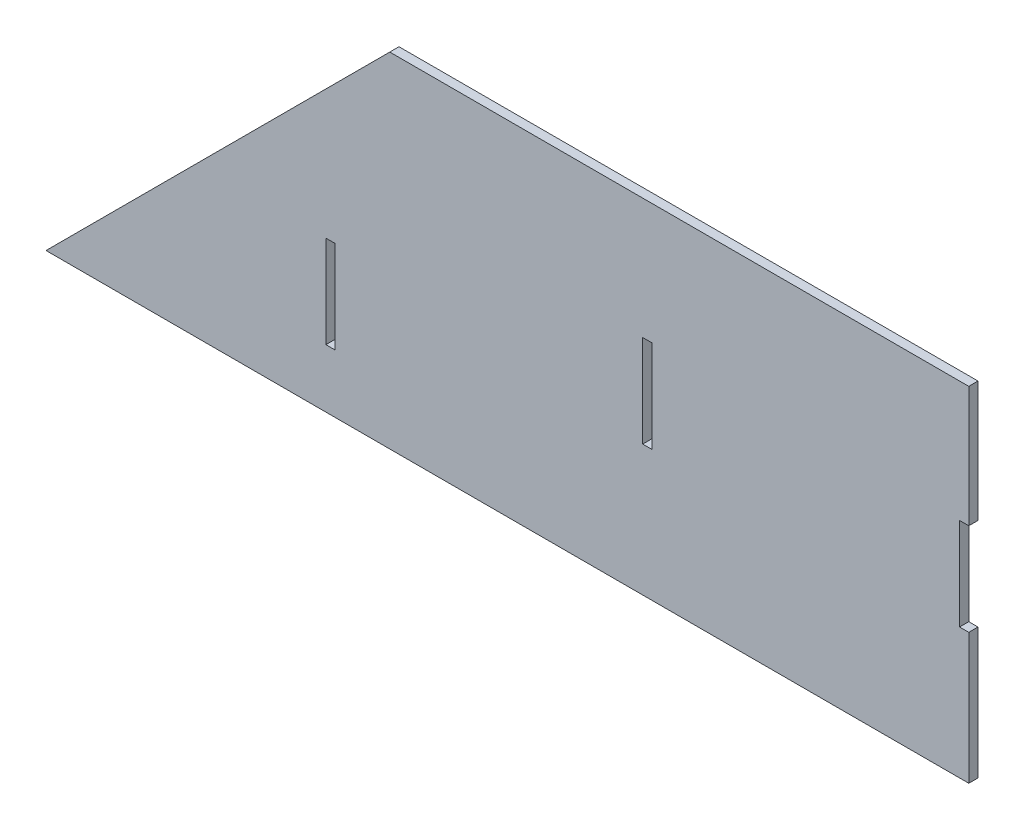
from build123d import *

# Parameters (mm, degrees)
SKETCH1_W           = 3
SKETCH1_H           = 30
BOSS_EXTRUDE1_DEPTH = 3


with BuildPart() as part:
    # Sketch1 → Boss-Extrude1 (new body)
    with BuildSketch(Plane.XY):
        Polygon((111.761566215, 111.761566215), (0, 0), (300, 0), (300, 42.5), (297, 42.5), (297, 72.5), (300, 72.5), (300, 111.761566215), align=None)
        with Locations((92.5, 33.992083592)):
            Rectangle(SKETCH1_W, SKETCH1_H, mode=Mode.SUBTRACT)
        with Locations((195.5, 57.5)):
            Rectangle(SKETCH1_W, SKETCH1_H, mode=Mode.SUBTRACT)
    extrude(amount=BOSS_EXTRUDE1_DEPTH)


solid = part.part
